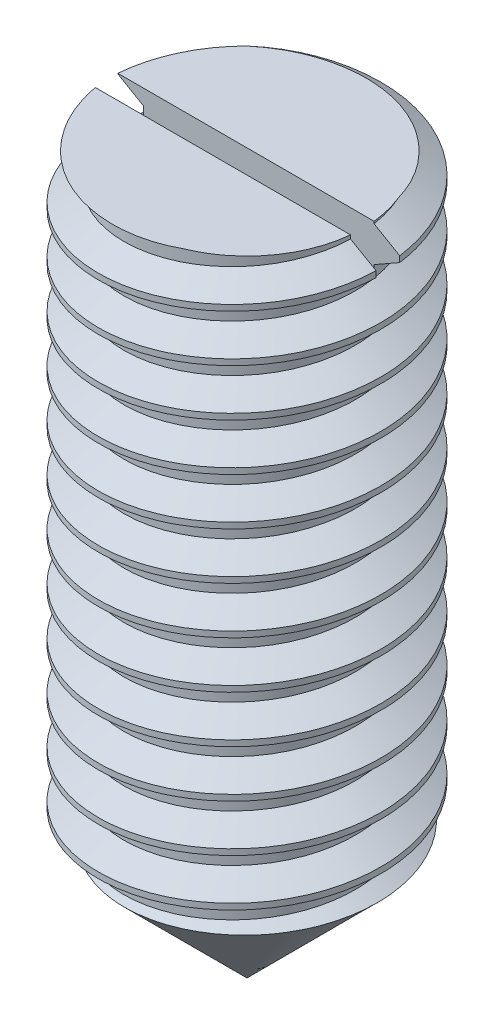
from build123d import *

# Parameters (mm, degrees)
THREAD1_PITCH           = 1
CUT_EXTRUDE1_DEPTH      = 16.588457403
CUT_EXTRUDE1_DEPTH_BACK = 1
SKETCH5_W               = 7.972092068
SKETCH5_H               = 0.5


with BuildPart() as part:
    # Sketch1 → Revolve1 (revolve)
    with BuildSketch(Plane.XY, mode=Mode.PRIVATE) as revolve1_sk:
        Polygon((0, 0), (-3, 3), (-3, 15), (0, 15), align=None)
    revolve(revolve1_sk.sketch.rotate(Axis((0, 0, 0), (0, 1, 0)), 90), axis=Axis((0, 0, 0), (0, 1, 0)))

    # Thread1: the profile of Thread Profile1 profile screwed along a right-hand helix of 40 turns, 8 arcs to a turn; built about Z, then put on its axis
    thread1_z = Axis((0, 0, 0), (0, 0, 1))
    thread1_corners = [(3.0003, 0, -0.000173205), (3.0003, 0, 0.875173202), (2.458734125, 0, 0.562499999), (2.458734125, 0, 0.312499999)]
    with BuildLine(mode=Mode.PRIVATE) as thread1_profile:
        Line(thread1_corners[0], thread1_corners[1])
        Line(thread1_corners[1], thread1_corners[2])
        Line(thread1_corners[2], thread1_corners[3])
        Line(thread1_corners[3], thread1_corners[0])
    thread1_cap = Face(thread1_profile.wire())
    thread1_turn_angles = [0, 22.5, 45, 67.5, 90, 112.5, 135, 157.5, 180, 202.5, 225, 247.5, 270, 292.5, 315, 337.5, 360]
    thread1_turn_weights = [1, 0.9238795325112867, 1, 0.9238795325112867, 1, 0.9238795325112867, 1, 0.9238795325112867, 1, 0.9238795325112867, 1, 0.9238795325112867, 1, 0.9238795325112867, 1, 0.9238795325112867, 1]
    thread1_turn_rails = [Edge.make_bspline([Vector(p[0], p[1], 0).rotate(thread1_z, thread1_turn_angles[k]) / thread1_turn_weights[k] + Vector(0, 0, p[2] + THREAD1_PITCH * thread1_turn_angles[k] / 360) for k in range(17)], [0, 0, 0, 1, 1, 2, 2, 3, 3, 4, 4, 5, 5, 6, 6, 7, 7, 8, 8, 8], 2, thread1_turn_weights) for p in thread1_corners]
    thread1_turn_sides = [Face.make_surface_from_curves(thread1_turn_rails[p[0]], thread1_turn_rails[p[1]]) for p in [(0, 1), (1, 2), (2, 3), (3, 0)]]
    thread1_turn = Solid(Shell([*thread1_turn_sides, thread1_cap, thread1_cap.rotate(thread1_z, 360).moved(Location((0, 0, THREAD1_PITCH * 360 / 360)))]))
    thread1_each = [*[thread1_turn.moved(Location((0, 0, THREAD1_PITCH * i))) for i in range(40)]]
    add(Plane(origin=(0, 20, 0), x_dir=(-1, 0, 0), z_dir=(0, -1, 0)) * Compound([thread1_each[i] for i in range(0, 40, 2)]), mode=Mode.SUBTRACT)
    add(Plane(origin=(0, 20, 0), x_dir=(-1, 0, 0), z_dir=(0, -1, 0)) * Compound([thread1_each[i] for i in range(1, 40, 2)]), mode=Mode.SUBTRACT)

    # Sketch5 → Cut-Extrude1 (cut, two sides: drawn at the far end of the back side and taken through both)
    with BuildSketch(Plane(origin=(0, 15, 0), x_dir=(1, 0, 0), z_dir=(0, 1, 0)).offset(-CUT_EXTRUDE1_DEPTH_BACK)):
        Rectangle(SKETCH5_W, SKETCH5_H)
    extrude(amount=CUT_EXTRUDE1_DEPTH + CUT_EXTRUDE1_DEPTH_BACK, mode=Mode.SUBTRACT)


solid = part.part
